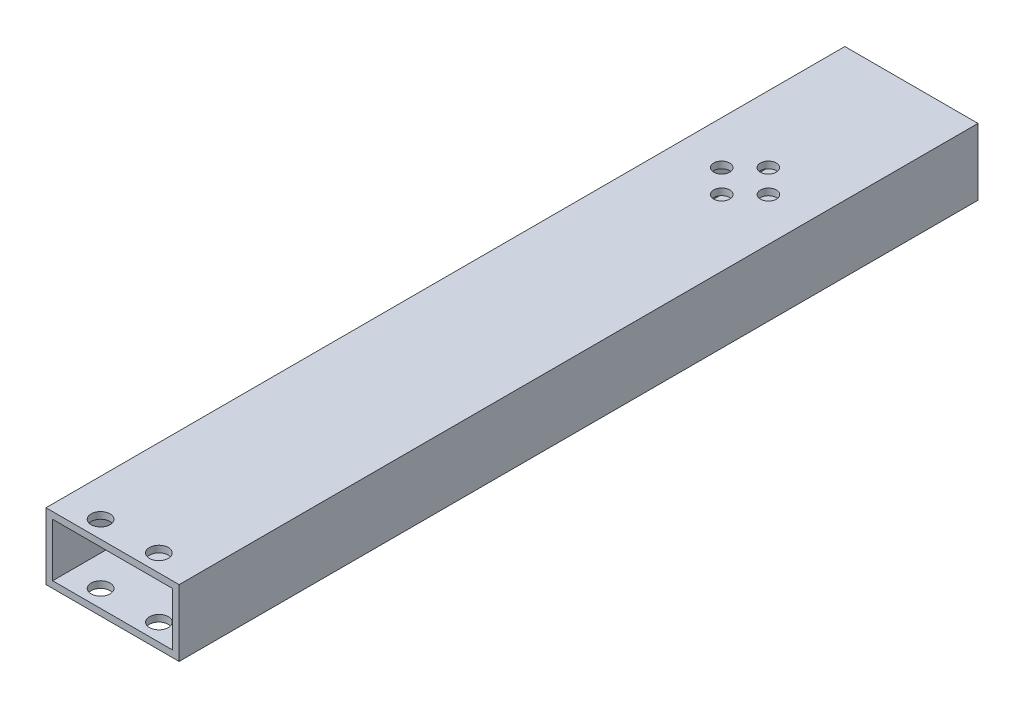
from build123d import *

# Parameters (mm, degrees)
SKETCH1_W               = 25.4
SKETCH1_H               = 12.7
BOSS_EXTRUDE1_DEPTH     = 127
SKETCH4_W               = 22.86
SKETCH4_H               = 10.16
CUT_EXTRUDE1_DEPTH      = 128.791284914
CUT_EXTRUDE2_DEPTH      = 129.263712717
CUT_EXTRUDE2_DEPTH_BACK = 129.263712717
SKETCH5_R               = 1.8034
CUT_EXTRUDE3_DEPTH      = 129.263712717
CUT_EXTRUDE3_DEPTH_BACK = 129.263712717
SKETCH6_R               = 1.524
SKETCH7_W               = 25.4
SKETCH7_H               = 12.7
SKETCH7_W_2             = 22.86
SKETCH7_H_2             = 10.16
BOSS_EXTRUDE2_DEPTH     = 25.4


with BuildPart() as part:
    # Sketch1 → Boss-Extrude1 (new body)
    with BuildSketch(Plane.XY):
        Rectangle(SKETCH1_W, SKETCH1_H)
    extrude(amount=BOSS_EXTRUDE1_DEPTH)

    # Sketch4 → Cut-Extrude1 (cut, through all)
    with BuildSketch(Plane(origin=(0, 0, 0), x_dir=(-1, 0, 0), z_dir=(0, 0, -1))):
        Rectangle(SKETCH4_W, SKETCH4_H)
    extrude(amount=-CUT_EXTRUDE1_DEPTH, mode=Mode.SUBTRACT)

    # Sketch5 → Cut-Extrude2 (cut, two sides: drawn at the far end of the back side and taken through both)
    with BuildSketch(Plane(origin=(0, 6.35, 0), x_dir=(1, 0, 0), z_dir=(0, 1, 0)).offset(-CUT_EXTRUDE2_DEPTH_BACK)):
        with Locations((-5.588, -123.698)):
            Circle(SKETCH5_R)
        with Locations((5.5372, -123.698)):
            Circle(SKETCH5_R)
    extrude(amount=CUT_EXTRUDE2_DEPTH + CUT_EXTRUDE2_DEPTH_BACK, mode=Mode.SUBTRACT)

    # Sketch6 → Cut-Extrude3 (cut, two sides: drawn at the far end of the back side and taken through both)
    with BuildSketch(Plane(origin=(0, -6.35, 0), x_dir=(-1, 0, 0), z_dir=(0, -1, 0)).offset(-CUT_EXTRUDE3_DEPTH_BACK)):
        with Locations((4.445, -6.35)):
            Circle(SKETCH6_R)
        with Locations((-4.4704, -6.35)):
            Circle(SKETCH6_R)
        with Locations((0, -1.905)):
            Circle(SKETCH6_R)
        with Locations((0, -10.795)):
            Circle(SKETCH6_R)
    extrude(amount=CUT_EXTRUDE3_DEPTH + CUT_EXTRUDE3_DEPTH_BACK, mode=Mode.SUBTRACT)

    # Sketch7 → Boss-Extrude2 (add)
    with BuildSketch(Plane(origin=(0, 0, 0), x_dir=(-1, 0, 0), z_dir=(0, 0, -1))):
        Rectangle(SKETCH7_W, SKETCH7_H)
        Rectangle(SKETCH7_W_2, SKETCH7_H_2, mode=Mode.SUBTRACT)
    extrude(amount=BOSS_EXTRUDE2_DEPTH)


solid = part.part
